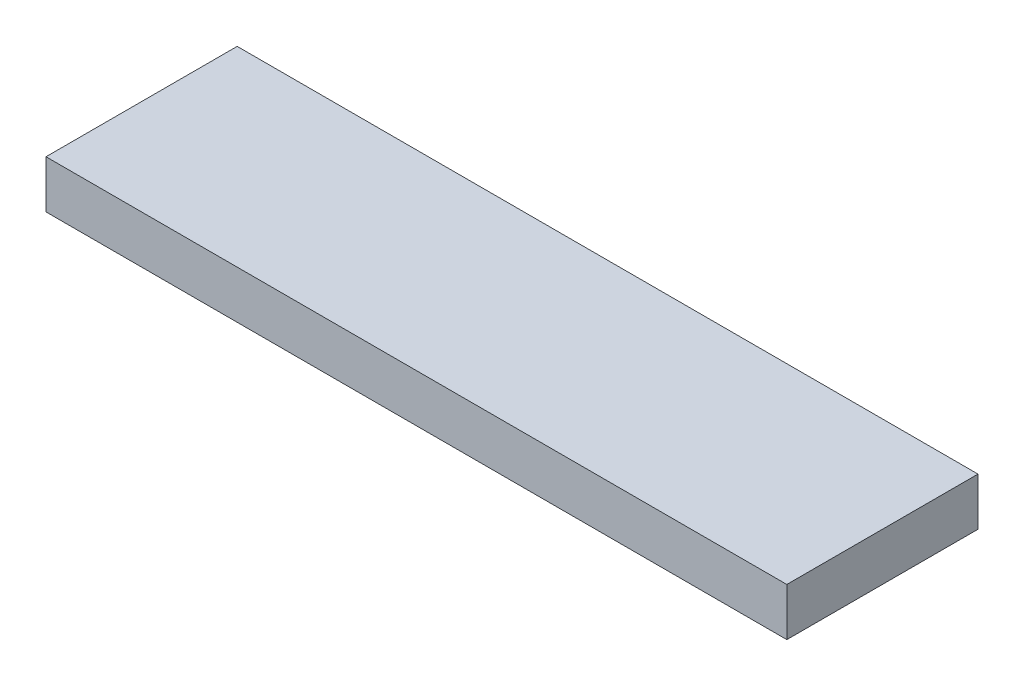
from build123d import *

# Parameters (mm, degrees)
SKETCH1_W           = 98.425
SKETCH1_H           = 25.4
BOSS_EXTRUDE1_DEPTH = 6.35


with BuildPart() as part:
    # Sketch1 → Boss-Extrude1 (new body)
    with BuildSketch(Plane(origin=(0, 0, 0), x_dir=(1, 0, 0), z_dir=(0, 1, 0))):
        with Locations((49.2125, 12.7)):
            Rectangle(SKETCH1_W, SKETCH1_H)
    extrude(amount=BOSS_EXTRUDE1_DEPTH)


solid = part.part
